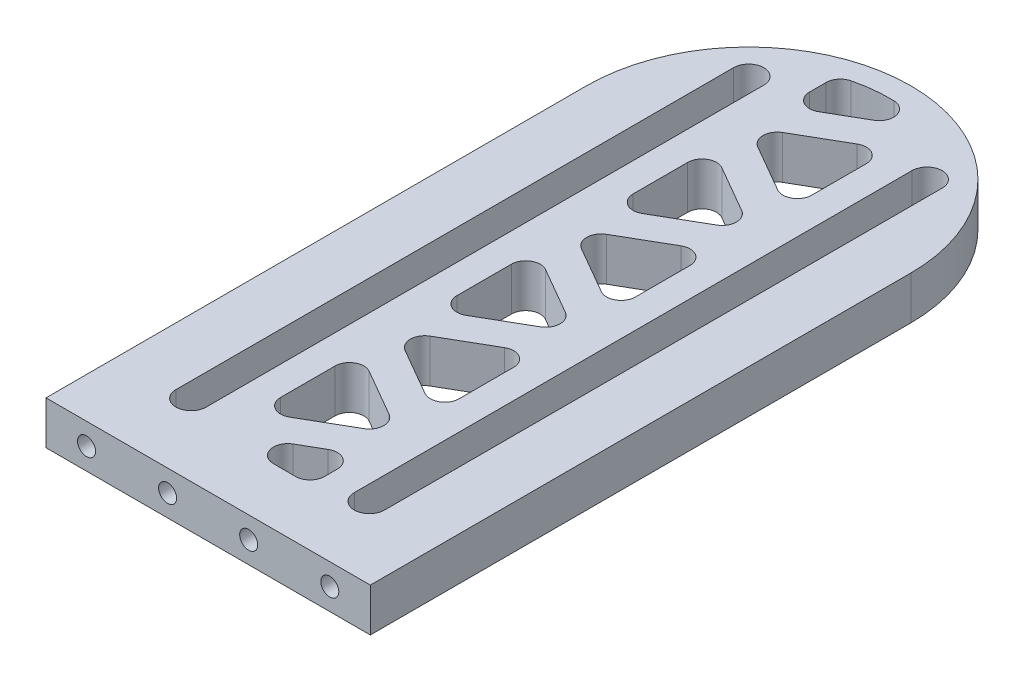
from build123d import *

# Parameters (mm, degrees)
EXTRUDE_1_DEPTH     = 6
CUT_EXTRUDE_1_DEPTH = 79.531840676
CUT_EXTRUDE_2_DEPTH = 79.531840676
FILLET_1_R          = 2
M3X0_51_D           = 2.5
M3X0_51_DEPTH       = 8.5
M3X0_51_TIP         = 0.751075774


with BuildPart() as part:
    # Эскиз1 → Бобышка-Вытянуть1 (new body)
    with BuildSketch(Plane(origin=(0, 0, 0), x_dir=(1, 0, 0), z_dir=(0, 1, 0))):
        with BuildLine():
            Line((-22.5, 0), (-22.5, -75))
            Line((-22.5, -75), (22.5, -75))
            Line((22.5, -75), (22.5, 0))
            ThreePointArc((22.5, 0), (0, 22.5), (-22.5, 0))
        make_face()
    extrude(amount=EXTRUDE_1_DEPTH)

    # Эскиз2 → Вырез-Вытянуть1 (cut, through all)
    with BuildSketch(Plane(origin=(0, 6, 0), x_dir=(1, 0, 0), z_dir=(0, 1, 0))):
        with BuildLine():
            Line((-10.274368671, 12.374368671), (-10.274368671, -65))
            ThreePointArc((-10.274368671, -65), (-12.374368671, -67.1), (-14.474368671, -65))
            Line((-14.474368671, -65), (-14.474368671, 12.374368671))
            ThreePointArc((-14.474368671, 12.374368671), (-12.374368671, 14.474368671), (-10.274368671, 12.374368671))
        make_face()
        with BuildLine():
            Line((10.274368671, 12.374368671), (10.274368671, -65))
            ThreePointArc((10.274368671, -65), (12.374368671, -67.1), (14.474368671, -65))
            Line((14.474368671, -65), (14.474368671, 12.374368671))
            ThreePointArc((14.474368671, 12.374368671), (12.374368671, 14.474368671), (10.274368671, 12.374368671))
        make_face()
    extrude(amount=-CUT_EXTRUDE_1_DEPTH, mode=Mode.SUBTRACT)

    # Эскиз11 → Вырез-Вытянуть2 (cut, through all)
    with BuildSketch(Plane(origin=(0, 6, 0), x_dir=(1, 0, 0), z_dir=(0, 1, 0))):
        with BuildLine():
            Line((6.274368671, 18.5), (-6.274368671, 11.254983118))
            Line((-6.274368671, 11.254983118), (-6.274368671, 18.5))
            ThreePointArc((-6.274368671, 18.5), (0, 19.535037809), (6.274368671, 18.5))
        make_face()
        Polygon((-6.274368671, 6.266676792), (6.274368671, 13.511693674), (6.274368671, -0.97834009), align=None)
        Polygon((-6.274368671, 1.278370466), (6.274368671, -5.966646416), (-6.274368671, -13.211663298), align=None)
        Polygon((-6.274368671, -18.199969624), (6.274368671, -10.954952742), (6.274368671, -25.444986506), align=None)
        Polygon((-6.274368671, -23.18827595), (6.274368671, -30.433292832), (-6.274368671, -37.678309714), align=None)
        Polygon((-6.274368671, -42.66661604), (6.274368671, -35.421599157), (6.274368671, -49.911632922), align=None)
        Polygon((-6.274368671, -47.654922365), (6.274368671, -54.899939248), (-6.274368671, -62.14495613), align=None)
        Polygon((-6.274368671, -67.133262455), (6.274368671, -67.133262455), (6.274368671, -59.888245573), align=None)
    extrude(amount=-CUT_EXTRUDE_2_DEPTH, mode=Mode.SUBTRACT)

    # Скругление1
    fillet_1_edges = [part.edges().sort_by_distance(p)[0] for p in [
        (6.274368671, 3, 67.133262455),
        (-6.274368671, 3, 67.133262455),
        (6.274368671, 3, 59.888245573),
        (-6.274368671, 3, 62.14495613),
        (6.274368671, 3, 54.899939248),
        (-6.274368671, 3, 47.654922365),
        (-6.274368671, 3, 42.66661604),
        (6.274368671, 3, 35.421599157),
        (6.274368671, 3, 49.911632922),
        (6.274368671, 3, 25.444986506),
        (6.274368671, 3, 10.954952742),
        (6.274368671, 3, 30.433292832),
        (-6.274368671, 3, 23.18827595),
        (-6.274368671, 3, 37.678309714),
        (-6.274368671, 3, 18.199969624),
        (-6.274368671, 3, 13.211663298),
        (6.274368671, 3, 5.966646416),
        (-6.274368671, 3, -1.278370466),
        (-6.274368671, 3, -6.266676792),
        (6.274368671, 3, 0.97834009),
        (6.274368671, 3, -18.5),
        (-6.274368671, 3, -18.5),
        (-6.274368671, 3, -11.254983118),
        (6.274368671, 3, -13.511693674),
    ]]
    fillet(fillet_1_edges, radius=FILLET_1_R)

    # Отверстие обработанное метчиком M3x0.51
    with Locations(Plane.XY.offset(75)):
        with Locations((-16.875, 3), (-5.625, 3), (5.625, 3), (16.875, 3)):
            Hole(M3X0_51_D / 2, depth=M3X0_51_DEPTH)
            with Locations((0, 0, -(M3X0_51_DEPTH + M3X0_51_TIP / 2))):  # 118° drill point
                Cone(0, M3X0_51_D / 2, M3X0_51_TIP, mode=Mode.SUBTRACT)


solid = part.part
